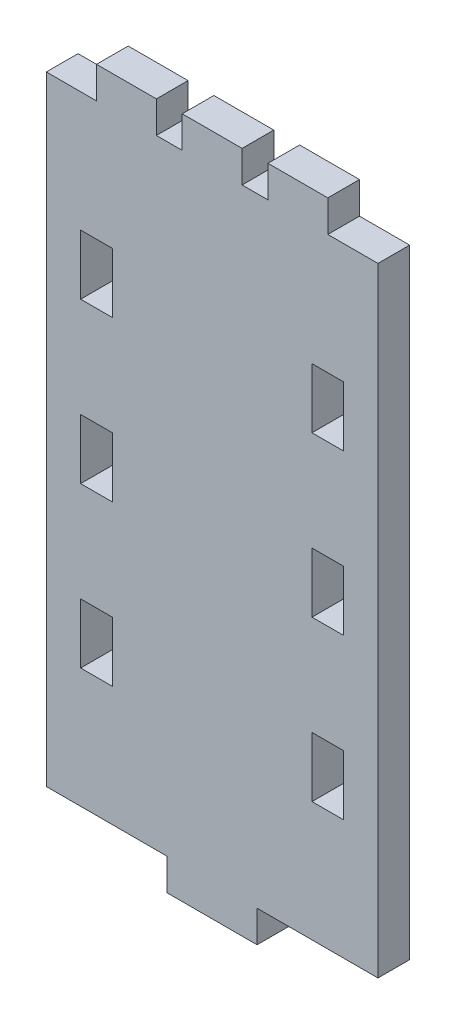
from build123d import *

# Parameters (mm, degrees)
SKETCH1_W           = 3.175
SKETCH1_H           = 6
BOSS_EXTRUDE1_DEPTH = 1.5875


with BuildPart() as part:
    # Sketch1 → Boss-Extrude1 (new, symmetric)
    with BuildSketch(Plane.XY):
        Polygon((0, 0), (-12.1125, 0), (-12.1125, -3.175), (-21.1125, -3.175), (-21.1125, 0), (-33.225, 0), (-33.225, 62), (-28.2, 62), (-28.2, 65.175), (-22.2, 65.175), (-22.2, 62), (-19.6125, 62), (-19.6125, 65.175), (-13.6125, 65.175), (-13.6125, 62), (-11.025, 62), (-11.025, 65.175), (-5.025, 65.175), (-5.025, 62), (0, 62), align=None)
        with Locations((-5.025, 15)):
            Rectangle(SKETCH1_W, SKETCH1_H, mode=Mode.SUBTRACT)
        Polygon((-5.025, 28), (-3.4375, 28), (-3.4375, 34), (-6.6125, 34), (-6.6125, 28), align=None, mode=Mode.SUBTRACT)
        Polygon((-5.025, 44), (-3.4375, 44), (-3.4375, 50), (-6.6125, 50), (-6.6125, 44), align=None, mode=Mode.SUBTRACT)
        Polygon((-26.6125, 44), (-28.2, 44), (-29.7875, 44), (-29.7875, 50), (-26.6125, 50), align=None, mode=Mode.SUBTRACT)
        Polygon((-26.6125, 28), (-28.2, 28), (-29.7875, 28), (-29.7875, 34), (-26.6125, 34), align=None, mode=Mode.SUBTRACT)
        with Locations((-28.2, 15)):
            Rectangle(SKETCH1_W, SKETCH1_H, mode=Mode.SUBTRACT)
    extrude(amount=BOSS_EXTRUDE1_DEPTH, both=True)


solid = part.part
